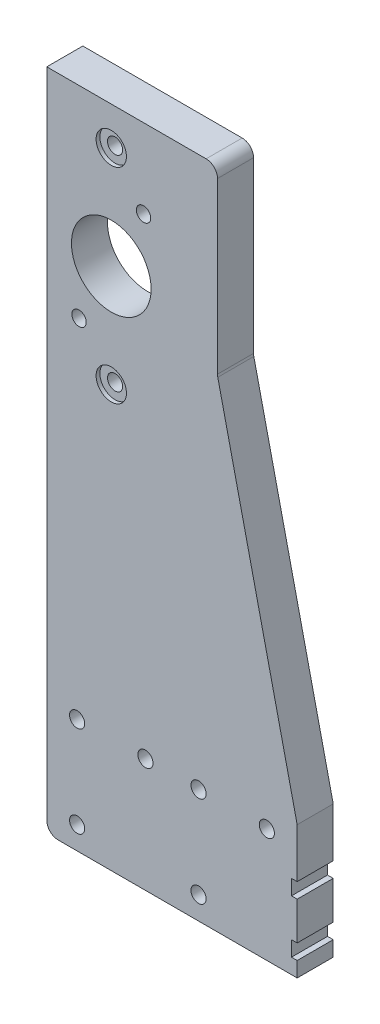
from build123d import *

# Parameters (mm, degrees)
EXTRUDE_1_DEPTH      = 9.5
SKETCH_6_R           = 2
CUT_EXTRUDE_5_DEPTH  = 188.27319616
SKETCH_7_R           = 4
CUT_EXTRUDE_6_DEPTH  = 1
FILLET_1_R           = 3
SKETCH_8_R           = 10.5
CUT_EXTRUDE_7_DEPTH  = 10
SKETCH_10_R          = 1.9
CUT_EXTRUDE_8_DEPTH  = 188.27319616
SKETCH_12_W          = 9.5
SKETCH_12_H          = 4
CUT_EXTRUDE_10_DEPTH = 1.5
SKETCH_15_R          = 2
CUT_EXTRUDE_13_DEPTH = 188.27319616
SKETCH_16_R          = 4
CUT_EXTRUDE_14_DEPTH = 4
CUT_EXTRUDE_START    = -4
SKETCH_18_R          = 4
CUT_EXTRUDE_15_DEPTH = 4


with BuildPart() as part:
    # 草图5 → 凸台-拉伸1 (new body)
    with BuildSketch(Plane.XY):
        Polygon((0, 0), (0, 175), (45, 175), (45, 127), (66, 35), (66, 0), align=None)
    extrude(amount=EXTRUDE_1_DEPTH)

    # 草图6 → 切除-拉伸5 (cut, through all)
    with BuildSketch(Plane.XY.offset(9.5)):
        with Locations((17, 165)):
            Circle(SKETCH_6_R)
        with Locations((17, 111)):
            Circle(SKETCH_6_R)
    extrude(amount=-CUT_EXTRUDE_5_DEPTH, mode=Mode.SUBTRACT)

    # 草图7 → 切除-拉伸6 (cut)
    with BuildSketch(Plane.XY.offset(9.5)):
        with Locations((17, 165)):
            Circle(SKETCH_7_R)
        with Locations((17, 111)):
            Circle(SKETCH_7_R)
    extrude(amount=-CUT_EXTRUDE_6_DEPTH, mode=Mode.SUBTRACT)

    # 圆角1
    fillet_1_edges = [part.edges().sort_by_distance(p)[0] for p in [
        (0, 0, 4.75),
        (45, 127, 4.75),
        (45, 175, 4.75),
    ]]
    fillet(fillet_1_edges, radius=FILLET_1_R)

    # 草图8 → 切除-拉伸7 (cut)
    with BuildSketch(Plane.XY.offset(9.5)):
        with Locations((17, 138)):
            Circle(SKETCH_8_R)
    extrude(amount=-CUT_EXTRUDE_7_DEPTH, mode=Mode.SUBTRACT)

    # 草图10 → 切除-拉伸8 (cut, through all)
    with BuildSketch(Plane.XY.offset(9.5)):
        with Locations((25.5, 154.1496904)):
            Circle(SKETCH_10_R)
        with Locations((8.5, 121.8503096)):
            Circle(SKETCH_10_R)
    extrude(amount=-CUT_EXTRUDE_8_DEPTH, mode=Mode.SUBTRACT)

    # 草图12 → 切除-拉伸10 (cut)
    with BuildSketch(Plane(origin=(66, 0, 0), x_dir=(0, 0, -1), z_dir=(1, 0, 0))):
        with Locations((-4.75, 6)):
            Rectangle(SKETCH_12_W, SKETCH_12_H)
        with Locations((-4.75, 20)):
            Rectangle(SKETCH_12_W, SKETCH_12_H)
    extrude(amount=-CUT_EXTRUDE_10_DEPTH, mode=Mode.SUBTRACT)

    # 草图15 → 切除-拉伸13 (cut, through all)
    with BuildSketch(Plane.XY.offset(9.5)):
        with Locations((58, 30.03)):
            Circle(SKETCH_15_R)
        with Locations((40, 30.03)):
            Circle(SKETCH_15_R)
        with Locations((26, 30.03)):
            Circle(SKETCH_15_R)
        with Locations((8, 30.03)):
            Circle(SKETCH_15_R)
        with Locations((40, 6.03)):
            Circle(SKETCH_15_R)
        with Locations((8, 6.03)):
            Circle(SKETCH_15_R)
    extrude(amount=-CUT_EXTRUDE_13_DEPTH, mode=Mode.SUBTRACT)

    # 草图16 → 切除-拉伸14 (cut)
    with BuildSketch(Plane(origin=(0, 0, 0), x_dir=(-1, 0, 0), z_dir=(0, 0, -1))):
        with Locations((-58, 30.03)):
            Circle(SKETCH_16_R)
        with Locations((-40, 30.03)):
            Circle(SKETCH_16_R)
        with Locations((-26, 30.03)):
            Circle(SKETCH_16_R)
        with Locations((-8, 30.03)):
            Circle(SKETCH_16_R)
        with Locations((-40, 6.03)):
            Circle(SKETCH_16_R)
        with Locations((-8, 6.03)):
            Circle(SKETCH_16_R)
    extrude(amount=-CUT_EXTRUDE_14_DEPTH, mode=Mode.SUBTRACT)

    # 草图18 → 切除-拉伸15 (cut)
    with BuildSketch(Plane(origin=(0, 0, 0), x_dir=(-1, 0, 0), z_dir=(0, 0, -1)).offset(CUT_EXTRUDE_START)):
        with Locations((-17, 111)):
            Circle(SKETCH_18_R)
        with Locations((-17, 165)):
            Circle(SKETCH_18_R)
    extrude(amount=CUT_EXTRUDE_15_DEPTH, mode=Mode.SUBTRACT)


solid = part.part
